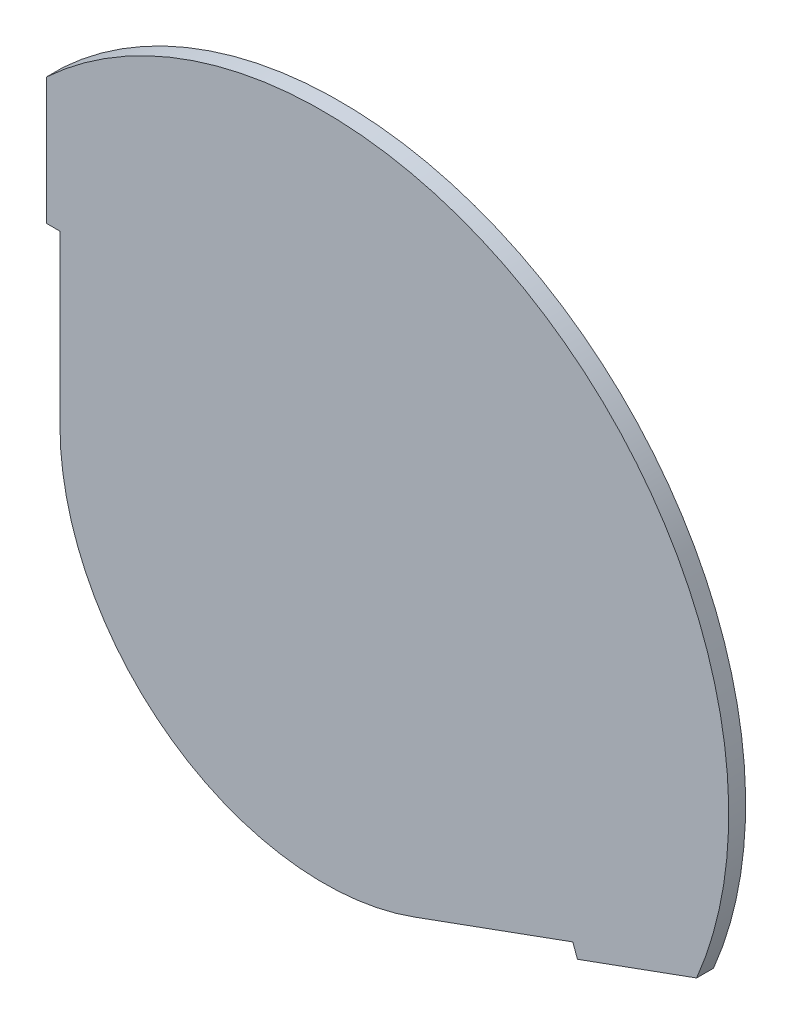
from build123d import *

# Parameters (mm, degrees)
BOSS_EXTRUDE1_DEPTH = 2.54


with BuildPart() as part:
    # Sketch1 → Boss-Extrude1 (new body)
    with BuildSketch(Plane.XY):
        with BuildLine():
            ThreePointArc((-39.624, 0), (-22.727392714, -32.458080603), (13.552206159, -37.234380406))
            Line((13.552206159, -37.234380406), (37.420398727, -28.547068766))
            Line((37.420398727, -28.547068766), (38.115383658, -30.456524171))
            Line((38.115383658, -30.456524171), (56.016528084, -23.941040441))
            ThreePointArc((56.016528084, -23.941040441), (34.849390419, 49.770087463), (-41.656, 44.45))
            Line((-41.656, 44.45), (-41.656, 25.4))
            Line((-41.656, 25.4), (-39.624, 25.4))
            Line((-39.624, 25.4), (-39.624, 0))
        make_face()
    extrude(amount=BOSS_EXTRUDE1_DEPTH)


solid = part.part
